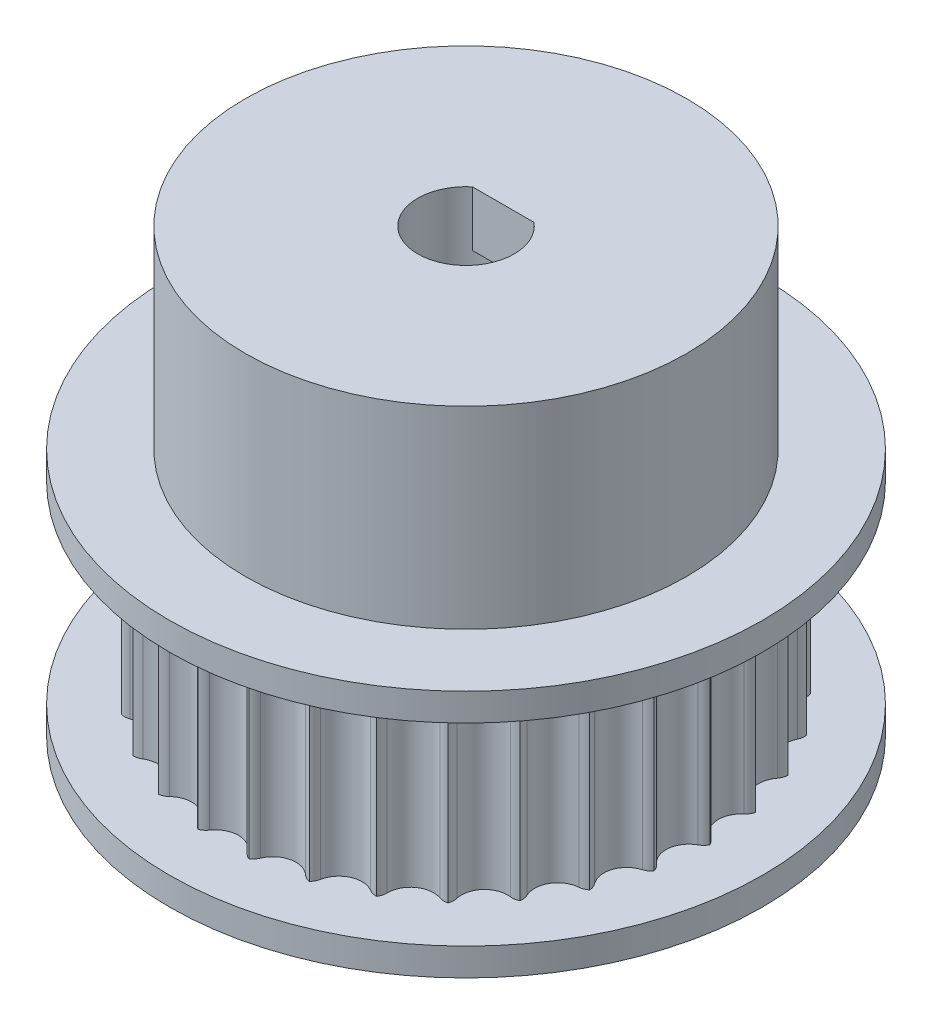
from build123d import *

# Parameters (mm, degrees)
CUT_EXTRUDE1_DEPTH      = 7
CIRPATTERN1_COUNT       = 30
CUT_EXTRUDE2_REACH      = 19.418
CUT_EXTRUDE2_END_RADIUS = 8
SKETCH3_R               = 1.65
CUT_EXTRUDE3_REACH      = 19.418
CUT_EXTRUDE3_END_RADIUS = 8
SKETCH4_R               = 1.65
CHAMFER1_SIZE           = 1
BOSS_EXTRUDE1_START     = -2
BOSS_EXTRUDE1_DEPTH     = 2


with BuildPart() as part:
    # Skica2 → Revolute (revolve)
    with BuildSketch(Plane.XY):
        Polygon((8, 8.5), (1.75, 8.5), (1.75, -8.5), (6.11, -8.5), (6.11, -7.5), (10.75, -7.5), (10.75, -6.5), (9.25, -6.5), (9.25, 0.5), (10.75, 0.5), (10.75, 1.5), (8, 1.5), align=None)
    revolve(axis=Axis((0, -8.5, 0), (0, 1, 0)))

    # Sketch2 → Cut-Extrude1 (cut)
    with BuildSketch(Plane.XZ.offset(-0.5)):
        with BuildLine():
            ThreePointArc((-0.688149825, 8.608192332), (0, 8.246880311), (0.688149825, 8.608192332))
            ThreePointArc((0.688149825, 8.608192332), (0.896854633, 8.78128412), (1.165221066, 8.819987111))
            ThreePointArc((1.165221066, 8.819987111), (1.389669154, 8.787418985), (1.61321413, 8.749140126))
            ThreePointArc((1.61321413, 8.749140126), (1.215542466, 9.923600007), (0, 10.168457672))
            ThreePointArc((0, 10.168457672), (-1.215542466, 9.923600007), (-1.61321413, 8.749140126))
            ThreePointArc((-1.61321413, 8.749140126), (-1.389669154, 8.787418985), (-1.165221066, 8.819987111))
            ThreePointArc((-1.165221066, 8.819987111), (-0.896854633, 8.78128412), (-0.688149825, 8.608192332))
        make_face()
    cut_extrude1 = extrude(amount=CUT_EXTRUDE1_DEPTH, mode=Mode.SUBTRACT)

    # CirPattern1: Cut-Extrude1 ×30 about axis
    cirpattern1_axis = Axis((0, 0, 0), (0, 1, 0))
    for i in range(1, CIRPATTERN1_COUNT):
        add(cut_extrude1.rotate(cirpattern1_axis, i * 360 / CIRPATTERN1_COUNT), mode=Mode.SUBTRACT)

    # Cut-Extrude2: up to this cylinder (the profile starts inside it)
    cut_extrude2_end = Plane(origin=(0, 4.5, 0), z_dir=(0, -1, 0)) * Cylinder(CUT_EXTRUDE2_END_RADIUS, 55.836, mode=Mode.PRIVATE)
    # Sketch3 → Cut-Extrude2 (cut, up to the surface)
    with BuildSketch(Plane(origin=(0, 0, 0), x_dir=(0, 0, -1), z_dir=(1, 0, 0)), mode=Mode.PRIVATE) as cut_extrude2_sk1:
        with Locations((0, 4.5)):
            Circle(SKETCH3_R)
    cut_extrude2_tool1 = extrude(cut_extrude2_sk1.sketch, amount=-CUT_EXTRUDE2_REACH, mode=Mode.PRIVATE) & cut_extrude2_end
    add(cut_extrude2_tool1.solids().sort_by_distance((0, 4.5, 0))[0], mode=Mode.SUBTRACT)

    # Cut-Extrude3: up to this cylinder (the profile starts inside it)
    cut_extrude3_end = Plane(origin=(0, 4.5, 0), z_dir=(0, -1, 0)) * Cylinder(CUT_EXTRUDE3_END_RADIUS, 55.836, mode=Mode.PRIVATE)
    # Sketch4 → Cut-Extrude3 (cut, up to the surface)
    with BuildSketch(Plane.XY, mode=Mode.PRIVATE) as cut_extrude3_sk1:
        with Locations((0, 4.5)):
            Circle(SKETCH4_R)
    cut_extrude3_tool1 = extrude(cut_extrude3_sk1.sketch, amount=-CUT_EXTRUDE3_REACH, mode=Mode.PRIVATE) & cut_extrude3_end
    add(cut_extrude3_tool1.solids().sort_by_distance((0, 4.5, 0))[0], mode=Mode.SUBTRACT)

    # Chamfer1
    chamfer1_edges = [part.edges().sort_by_distance(p)[0] for p in [
        (-6.11, -7.5, 0),
    ]]
    chamfer(chamfer1_edges, length=CHAMFER1_SIZE - 0.0001)  # a hair under: the kernel refuses the full size

    # Sketch6 → Boss-Extrude1 (add)
    with BuildSketch(Plane(origin=(0, 8.5, 0), x_dir=(1, 0, 0), z_dir=(0, 1, 0)).offset(BOSS_EXTRUDE1_START)):
        with BuildLine():
            Line((-1.113552873, 1.35), (1.113552873, 1.35))
            ThreePointArc((1.113552873, 1.35), (0, 1.75), (-1.113552873, 1.35))
        make_face()
    extrude(amount=BOSS_EXTRUDE1_DEPTH)


solid = part.part
